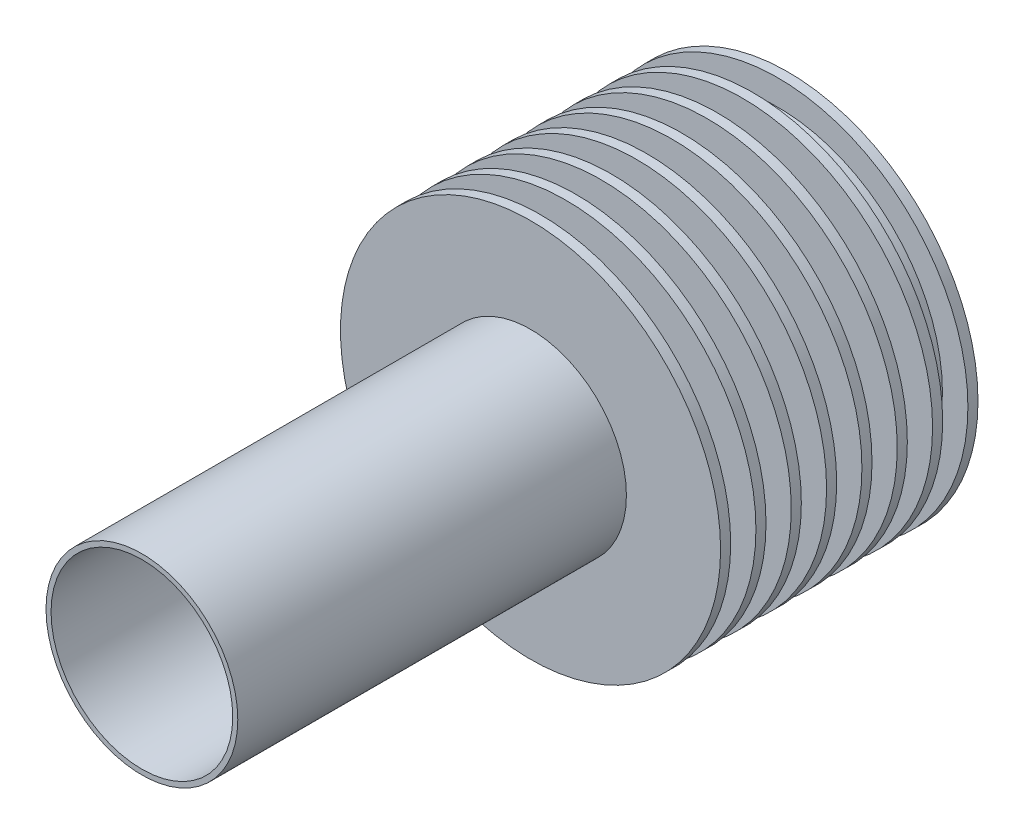
from build123d import *
from build123d.topology import SkipClean

# Parameters (mm, degrees)
SKETCH1_R                               = 19
BOSS_EXTRUDE1_DEPTH                     = 128
SKETCH4_R                               = 2.5
CUT_EXTRUDE1_DEPTH                      = 9
CBORE_FOR_M6_HEX_HEAD_BOLT1_D           = 36
CBORE_FOR_M6_HEX_HEAD_BOLT1_CBORE_D     = 46
CBORE_FOR_M6_HEX_HEAD_BOLT1_CBORE_DEPTH = 3
THREAD1_PITCH                           = 0.8
CIRPATTERN1_COUNT                       = 4


with BuildPart() as part:
    # Sketch1 → Boss-Extrude1 (new body)
    with BuildSketch(Plane.XY):
        Circle(SKETCH1_R)
    extrude(amount=BOSS_EXTRUDE1_DEPTH)

    # Sketch3 → Revolve1 (revolve)
    with BuildSketch(Plane(origin=(0, 0, 0), x_dir=(0, 0, -1), z_dir=(1, 0, 0)), mode=Mode.PRIVATE) as revolve1_sk:
        Polygon((-51, 19.157628646), (-51, 37.657628646), (-49, 37.657628646), (-49, 19.157628646), (-44, 19.157628646), (-44, 37.657628646), (-42, 37.657628646), (-42, 19.157628646), (-37, 19.157628646), (-37, 37.657628646), (-35, 37.657628646), (-35, 19.157628646), (-30, 19.157628646), (-30, 37.657628646), (-28, 37.657628646), (-28, 19.157628646), (-23, 19.157628646), (-23, 37.657628646), (-21, 37.657628646), (-21, 19.157628646), (-16, 19.157628646), (-16, 37.657628646), (-14, 37.657628646), (-14, 19.157628646), (-9, 19.157628646), (-9, 37.657628646), (-7, 37.657628646), (-7, 32.612935063), (-2, 32.612935063), (-2, 37.657628646), (0, 37.657628646), (0, 19.157628646), (0, 18.657628646), (-51, 18.657628646), align=None)
    revolve(revolve1_sk.sketch.rotate(Axis((0, 0, 128), (0, 0, -1)), 90), axis=Axis((0, 0, 128), (0, 0, -1)))

    # Sketch4 → Cut-Extrude1 (cut)
    with BuildSketch(Plane(origin=(0, 0, 0), x_dir=(-1, 0, 0), z_dir=(0, 0, -1))):
        with Locations((0, 27.5)):
            Circle(SKETCH4_R)
        with Locations((0, -27.5)):
            Circle(SKETCH4_R)
        with Locations((-27.5, 0)):
            Circle(SKETCH4_R)
        with Locations((27.5, 0)):
            Circle(SKETCH4_R)
    extrude(amount=-CUT_EXTRUDE1_DEPTH, mode=Mode.SUBTRACT)

    # CBORE for M6 Hex Head Bolt1 (through all)
    with Locations(Plane(origin=(0, 0, 0), x_dir=(-1, 0, 0), z_dir=(0, 0, -1))):
        with Locations((0, 0)):
            CounterBoreHole(CBORE_FOR_M6_HEX_HEAD_BOLT1_D / 2, CBORE_FOR_M6_HEX_HEAD_BOLT1_CBORE_D / 2, CBORE_FOR_M6_HEX_HEAD_BOLT1_CBORE_DEPTH)

    # Thread1: the profile of Thread Profile1 profile screwed along a right-hand helix of 11.25 turns, 8 arcs to a turn; built about Z, then put on its axis
    with SkipClean():  # the faces are left unmerged after this step: merging them gives an invalid solid
        thread1_z = Axis((0, 0, 0), (0, 0, 1))
        thread1_corners = [(2.4997, 0, -0.000173205), (2.9330127, 0, 0.249999999), (2.9330127, 0, 0.349999999), (2.4997, 0, 0.600173203)]
        with BuildLine(mode=Mode.PRIVATE) as thread1_profile:
            Line(thread1_corners[0], thread1_corners[1])
            Line(thread1_corners[1], thread1_corners[2])
            Line(thread1_corners[2], thread1_corners[3])
            Line(thread1_corners[3], thread1_corners[0])
        thread1_cap = Face(thread1_profile.wire())
        thread1_turn_angles = [0, 22.5, 45, 67.5, 90, 112.5, 135, 157.5, 180, 202.5, 225, 247.5, 270, 292.5, 315, 337.5, 360]
        thread1_turn_weights = [1, 0.9238795325112867, 1, 0.9238795325112867, 1, 0.9238795325112867, 1, 0.9238795325112867, 1, 0.9238795325112867, 1, 0.9238795325112867, 1, 0.9238795325112867, 1, 0.9238795325112867, 1]
        thread1_turn_rails = [Edge.make_bspline([Vector(p[0], p[1], 0).rotate(thread1_z, thread1_turn_angles[k]) / thread1_turn_weights[k] + Vector(0, 0, p[2] + THREAD1_PITCH * thread1_turn_angles[k] / 360) for k in range(17)], [0, 0, 0, 1, 1, 2, 2, 3, 3, 4, 4, 5, 5, 6, 6, 7, 7, 8, 8, 8], 2, thread1_turn_weights) for p in thread1_corners]
        thread1_turn_sides = [Face.make_surface_from_curves(thread1_turn_rails[p[0]], thread1_turn_rails[p[1]]) for p in [(0, 1), (1, 2), (2, 3), (3, 0)]]
        thread1_last_angles = [3960, 3982.5, 4005, 4027.5, 4050]
        thread1_last_weights = [1, 0.9238795325112867, 1, 0.9238795325112852, 1]
        thread1_last_rails = [Edge.make_bspline([Vector(p[0], p[1], 0).rotate(thread1_z, thread1_last_angles[k]) / thread1_last_weights[k] + Vector(0, 0, p[2] + THREAD1_PITCH * thread1_last_angles[k] / 360) for k in range(5)], [0, 0, 0, 1, 1, 2, 2, 2], 2, thread1_last_weights) for p in thread1_corners]
        thread1_last_sides = [Face.make_surface_from_curves(thread1_last_rails[p[0]], thread1_last_rails[p[1]]) for p in [(0, 1), (1, 2), (2, 3), (3, 0)]]
        thread1 = Plane(origin=(0, 27.5, 0), x_dir=(1, 0, 0), z_dir=(0, 0, 1)) * Solid(Shell([*[p.moved(Location((0, 0, THREAD1_PITCH * i))) for i in range(11) for p in thread1_turn_sides], *thread1_last_sides, thread1_cap, thread1_cap.rotate(thread1_z, 4050).moved(Location((0, 0, THREAD1_PITCH * 4050 / 360)))]))
        add(thread1, mode=Mode.SUBTRACT)

    # CirPattern1: Thread1 ×4 about axis
    with SkipClean():  # the faces are left unmerged after this step: merging them gives an invalid solid
        cirpattern1_axis = Axis((0, 0, 128), (0, 0, -1))
        for i in range(1, CIRPATTERN1_COUNT):
            add(thread1.rotate(cirpattern1_axis, i * 360 / CIRPATTERN1_COUNT), mode=Mode.SUBTRACT)


solid = part.part
